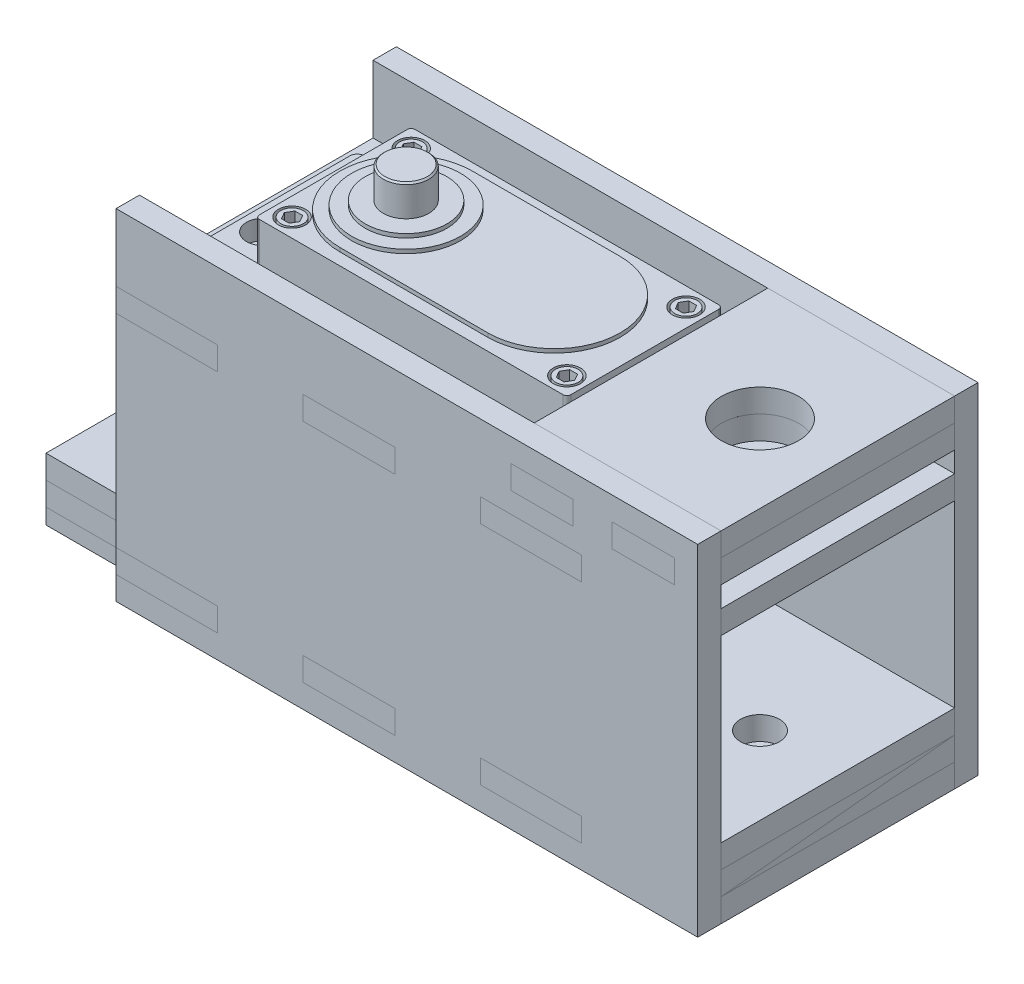
from build123d import *

# Parameters (mm, degrees)
SKETCH_1_W           = 40
SKETCH_1_H           = 37.7
EXTRUDE_1_DEPTH      = 20
SKETCH_2_R           = 1.75
CUT_EXTRUDE_1_DEPTH  = 1.5
SKETCH_3_R           = 1.45
EXTRUDE_2_DEPTH      = 1.5
EXTRUDE_3_DEPTH      = 0.5
SKETCH_5_R           = 7
EXTRUDE_4_DEPTH      = 0.5
SKETCH_6_R           = 5.25
EXTRUDE_5_DEPTH      = 0.5
SKETCH_7_R           = 2.925
EXTRUDE_6_DEPTH      = 4
CHAMFER_1_SIZE       = 0.2
SKETCH_8_W           = 53.8
SKETCH_8_H           = 2.5
EXTRUDE_7_DEPTH      = 20
FILLET_1_R           = 1
SKETCH_9_R           = 2.15
CUT_EXTRUDE_2_DEPTH  = 4
FILLET_2_R           = 0.5
SKETCH_10_W          = 83.8
SKETCH_10_H          = 30
SKETCH_10_R          = 1.25
EXTRUDE_8_DEPTH      = 3
SKETCH_11_W          = 13
SKETCH_11_H          = 3
SKETCH_11_W_2        = 11.8
EXTRUDE_9_DEPTH      = 3
SKETCH_14_W          = 83.8
SKETCH_14_H          = 42.7
SKETCH_14_W_2        = 13
SKETCH_14_H_2        = 3
SKETCH_14_W_3        = 11.8
EXTRUDE_10_DEPTH     = 3
SKETCH_15_W          = 30
SKETCH_15_H          = 3
EXTRUDE_11_DEPTH     = 15
SKETCH_16_W          = 3
SKETCH_16_H          = 42.7
EXTRUDE_12_DEPTH     = 15
SKETCH_17_W          = 3
SKETCH_17_H          = 42.7
EXTRUDE_13_DEPTH     = 15
SKETCH_18_R          = 2.5
CUT_EXTRUDE_3_DEPTH  = 15
SKETCH_19_W          = 25
SKETCH_19_H          = 3
EXTRUDE_14_DEPTH     = 8
SKETCH_20_W          = 25
SKETCH_20_H          = 3
EXTRUDE_15_DEPTH     = 8
SKETCH_21_W          = 30
SKETCH_21_H          = 3
EXTRUDE_16_DEPTH     = 25
SKETCH_22_R          = 2.5
CUT_EXTRUDE_4_DEPTH  = 10
CUT_EXTRUDE_5_DEPTH  = 100
SKETCH_25_W          = 92.969292527
SKETCH_25_H          = 30
EXTRUDE_17_DEPTH     = 3
EXTRUDE_18_DEPTH     = 3
SKETCH_27_R          = 2.5
CUT_EXTRUDE_6_DEPTH  = 3
EXTRUDE_19_DEPTH     = 5
SKETCH_29_R          = 2.5
CUT_EXTRUDE_7_DEPTH  = 13
SKETCH_30_W          = 27.06910603
SKETCH_30_H          = 61.515180942
CUT_EXTRUDE_8_DEPTH  = 76
SKETCH_31_W          = 30
SKETCH_31_H          = 3
EXTRUDE_20_DEPTH     = 10
SKETCH_32_W          = 3
SKETCH_32_H          = 50.7
EXTRUDE_21_DEPTH     = 10
SKETCH_33_W          = 3
SKETCH_33_H          = 50.7
EXTRUDE_22_DEPTH     = 10
SKETCH_34_W          = 30
SKETCH_34_H          = 3
EXTRUDE_23_DEPTH     = 10
SKETCH_35_W          = 30
SKETCH_35_H          = 3
EXTRUDE_24_DEPTH     = 10
SKETCH_36_R          = 2.5
CUT_EXTRUDE_9_DEPTH  = 90
SKETCH_37_W          = 86.7
SKETCH_37_H          = 30
EXTRUDE_25_DEPTH     = 3
SKETCH_38_W          = 86.7
SKETCH_38_H          = 3
EXTRUDE_26_DEPTH     = 1
SKETCH_39_W          = 86.7
SKETCH_39_H          = 3
EXTRUDE_27_DEPTH     = 1
SKETCH_40_W          = 13
SKETCH_40_H          = 3
SKETCH_40_W_2        = 11.8
CUT_EXTRUDE_10_DEPTH = 45
SKETCH_41_W          = 13
SKETCH_41_H          = 3
SKETCH_41_W_2        = 11.8
CUT_EXTRUDE_11_DEPTH = 59
EXTRUDE_28_DEPTH     = 3
SKETCH_43_W          = 3
SKETCH_43_H          = 8
EXTRUDE_29_DEPTH     = 3
SKETCH_44_W          = 3
SKETCH_44_H          = 8
EXTRUDE_30_DEPTH     = 3
SKETCH_45_W          = 30
SKETCH_45_H          = 3
EXTRUDE_31_DEPTH     = 3
SKETCH_50_W          = 49.998763717
SKETCH_50_H          = 60.966477852
CUT_EXTRUDE_12_DEPTH = 12
SKETCH_51_R          = 4.95
CUT_EXTRUDE_13_DEPTH = 66
SKETCH_52_W          = 30
SKETCH_52_H          = 3
EXTRUDE_36_DEPTH     = 2
SKETCH_53_W          = 26.558022485
SKETCH_53_H          = 47.961323307
CUT_EXTRUDE_14_DEPTH = 8
SKETCH_54_W          = 15
SKETCH_54_H          = 3
EXTRUDE_37_DEPTH     = 5
SKETCH_55_W          = 8
SKETCH_55_H          = 3
CUT_EXTRUDE_15_DEPTH = 50
SKETCH_56_W          = 3
SKETCH_56_H          = 5
CUT_EXTRUDE_16_DEPTH = 50
EXTRUDE_38_DEPTH     = 3
SKETCH_59_R          = 4.95
CUT_EXTRUDE_17_DEPTH = 25
SKETCH_60_W          = 24
SKETCH_60_H          = 30
SKETCH_60_R          = 4.95
EXTRUDE_39_DEPTH     = 3
SKETCH_61_W          = 24
SKETCH_61_H          = 30
SKETCH_61_R          = 4.95
EXTRUDE_40_DEPTH     = 3


with BuildPart() as part:
    # 草图1 → 凸台-拉伸1 (new body)
    with BuildSketch(Plane.XY):
        Rectangle(SKETCH_1_W, SKETCH_1_H)
    extrude(amount=EXTRUDE_1_DEPTH)

    # 草图2 → 切除-拉伸1 (cut)
    with BuildSketch(Plane(origin=(0, 18.85, 0), x_dir=(1, 0, 0), z_dir=(0, 1, 0))):
        with Locations(Location((-17.65, -2.35, 0), (0, 0, 270))):
            Circle(SKETCH_2_R)
        with Locations(Location((17.65, -2.35, 0), (0, 0, 90))):
            Circle(SKETCH_2_R)
        with Locations(Location((17.65, -17.65, 0), (0, 0, 270))):
            Circle(SKETCH_2_R)
        with Locations(Location((-17.65, -17.65, 0), (0, 0, 90))):
            Circle(SKETCH_2_R)
    cut_extrude_1 = extrude(amount=-CUT_EXTRUDE_1_DEPTH, mode=Mode.SUBTRACT)

    # 草图3 → 凸台-拉伸2 (add)
    # profile 1 of 4: a face of its own
    with BuildSketch(Plane(origin=(0, 17.35, 0), x_dir=(1, 0, 0), z_dir=(0, 1, 0))):
        with Locations(Location((-17.65, -2.35, 0), (0, 0, 270))):
            Circle(SKETCH_3_R)
        Polygon((-17.15, -1.483974596), (-18.15, -1.483974596), (-18.65, -2.35), (-18.15, -3.216025404), (-17.15, -3.216025404), (-16.65, -2.35), align=None, mode=Mode.SUBTRACT)
    # profile 2 of 4: a face of its own
    with BuildSketch(Plane(origin=(0, 17.35, 0), x_dir=(1, 0, 0), z_dir=(0, 1, 0))):
        with Locations(Location((17.65, -2.35, 0), (0, 0, 90))):
            Circle(SKETCH_3_R)
        Polygon((16.65, -2.35), (17.15, -1.483974596), (18.15, -1.483974596), (18.65, -2.35), (18.15, -3.216025404), (17.15, -3.216025404), align=None, mode=Mode.SUBTRACT)
    # profile 3 of 4: a face of its own
    with BuildSketch(Plane(origin=(0, 17.35, 0), x_dir=(1, 0, 0), z_dir=(0, 1, 0))):
        with Locations(Location((-17.65, -17.65, 0), (0, 0, 90))):
            Circle(SKETCH_3_R)
        Polygon((-17.15, -18.516025404), (-18.15, -18.516025404), (-18.65, -17.65), (-18.15, -16.783974596), (-17.15, -16.783974596), (-16.65, -17.65), align=None, mode=Mode.SUBTRACT)
    # profile 4 of 4: a face of its own
    with BuildSketch(Plane(origin=(0, 17.35, 0), x_dir=(1, 0, 0), z_dir=(0, 1, 0))):
        with Locations(Location((17.65, -17.65, 0), (0, 0, 270))):
            Circle(SKETCH_3_R)
        Polygon((16.65, -17.65), (17.15, -18.516025404), (18.15, -18.516025404), (18.65, -17.65), (18.15, -16.783974596), (17.15, -16.783974596), align=None, mode=Mode.SUBTRACT)
    extrude_2 = extrude(amount=EXTRUDE_2_DEPTH)

    # 草图4 → 凸台-拉伸3 (add)
    with BuildSketch(Plane(origin=(0, 18.85, 0), x_dir=(1, 0, 0), z_dir=(0, 1, 0))):
        with BuildLine():
            Line((-10.7, -1.45), (8.3, -1.45))
            ThreePointArc((8.3, -1.45), (16.8, -9.95), (8.3, -18.45))
            Line((8.3, -18.45), (-10.7, -18.45))
            ThreePointArc((-10.7, -18.45), (-19.2, -9.95), (-10.7, -1.45))
        make_face()
    extrude(amount=EXTRUDE_3_DEPTH)

    # 草图5 → 凸台-拉伸4 (add)
    with BuildSketch(Plane(origin=(0, 19.35, 0), x_dir=(1, 0, 0), z_dir=(0, 1, 0))):
        with Locations(Location((-10.7, -9.95, 0), (0, 0, 270))):
            Circle(SKETCH_5_R)
    extrude(amount=EXTRUDE_4_DEPTH)

    # 草图6 → 凸台-拉伸5 (add)
    with BuildSketch(Plane(origin=(0, 19.85, 0), x_dir=(1, 0, 0), z_dir=(0, 1, 0))):
        with Locations(Location((-10.7, -9.95, 0), (0, 0, 270))):
            Circle(SKETCH_6_R)
    extrude(amount=EXTRUDE_5_DEPTH)

    # 草图7 → 凸台-拉伸6 (add)
    with BuildSketch(Plane(origin=(0, 20.35, 0), x_dir=(1, 0, 0), z_dir=(0, 1, 0))):
        with Locations(Location((-10.7, -9.95, 0), (0, 0, 270))):
            Circle(SKETCH_7_R)
    extrude(amount=EXTRUDE_6_DEPTH)

    # 倒角1
    chamfer_1_edges = [part.edges().sort_by_distance(p)[0] for p in [
        (-10.7, 24.35, 7.025),
    ]]
    chamfer(chamfer_1_edges, length=CHAMFER_1_SIZE)

    # 草图8 → 凸台-拉伸7 (add)
    with BuildSketch(Plane.XY.offset(20)):
        with Locations((0, 11.45)):
            Rectangle(SKETCH_8_W, SKETCH_8_H)
    extrude(amount=-EXTRUDE_7_DEPTH)

    # 镜向1: 切除-拉伸1, 凸台-拉伸2 across plane
    add(cut_extrude_1.mirror(Plane.ZX), mode=Mode.SUBTRACT)
    add(extrude_2.mirror(Plane.ZX))

    # 圆角1
    fillet_1_edges = [part.edges().sort_by_distance(p)[0] for p in [
        (26.9, 11.45, 20),
        (-26.9, 11.45, 20),
        (26.9, 11.45, 0),
        (-26.9, 11.45, 0),
    ]]
    fillet(fillet_1_edges, radius=FILLET_1_R)

    # 草图9 → 切除-拉伸2 (cut)
    with BuildSketch(Plane(origin=(0, 12.7, 0), x_dir=(1, 0, 0), z_dir=(0, 1, 0))):
        with Locations(Location((-24, -5, 0), (0, 0, 270))):
            Circle(SKETCH_9_R)
        with Locations(Location((-24, -15, 0), (0, 0, 270))):
            Circle(SKETCH_9_R)
        with Locations(Location((24, -15, 0), (0, 0, 90))):
            Circle(SKETCH_9_R)
        with Locations(Location((24, -5, 0), (0, 0, 90))):
            Circle(SKETCH_9_R)
    extrude(amount=-CUT_EXTRUDE_2_DEPTH, mode=Mode.SUBTRACT)

    # 圆角2
    fillet_2_edges = [part.edges().sort_by_distance(p)[0] for p in [
        (-20, 15.775, 20),
        (20, 15.775, 0),
        (-20, -4.325, 0),
        (20, 15.775, 20),
        (-20, -4.325, 20),
        (20, -4.325, 20),
        (-20, 15.775, 0),
        (20, -4.325, 0),
    ]]
    fillet(fillet_2_edges, radius=FILLET_2_R)


with BuildPart() as body_2:
    # 草图10 → 凸台-拉伸8 (new body)
    with BuildSketch(Plane.XZ.offset(-10.2)):
        with Locations((0, 10)):
            Rectangle(SKETCH_10_W, SKETCH_10_H)
        with Locations(Location((-24, 15, 0), (0, 0, 270))):
            Circle(SKETCH_10_R, mode=Mode.SUBTRACT)
        with Locations(Location((-24, 5, 0), (0, 0, 270))):
            Circle(SKETCH_10_R, mode=Mode.SUBTRACT)
        with Locations(Location((24, 5, 0), (0, 0, 270))):
            Circle(SKETCH_10_R, mode=Mode.SUBTRACT)
        with Locations(Location((24, 15, 0), (0, 0, 270))):
            Circle(SKETCH_10_R, mode=Mode.SUBTRACT)
        with BuildLine():
            Line((20, 19.5), (20, 0.5))
            ThreePointArc((20, 0.5), (19.853553391, 0.146446609), (19.5, 0))
            Line((19.5, 0), (-19.5, 0))
            ThreePointArc((-19.5, 0), (-19.853553391, 0.146446609), (-20, 0.5))
            Line((-20, 0.5), (-20, 19.5))
            ThreePointArc((-20, 19.5), (-19.853553391, 19.853553391), (-19.5, 20))
            Line((-19.5, 20), (19.5, 20))
            ThreePointArc((19.5, 20), (19.853553391, 19.853553391), (20, 19.5))
        make_face(mode=Mode.SUBTRACT)
    extrude(amount=EXTRUDE_8_DEPTH)

    # 草图11 → 凸台-拉伸9 (add)
    with BuildSketch(Plane(origin=(0, 0, -5), x_dir=(-1, 0, 0), z_dir=(0, 0, -1))):
        with Locations((-23.4, 8.7)):
            Rectangle(SKETCH_11_W, SKETCH_11_H)
        with Locations((23.4, 8.7)):
            Rectangle(SKETCH_11_W, SKETCH_11_H)
        with Locations((0, 8.7)):
            Rectangle(SKETCH_11_W_2, SKETCH_11_H)
    extrude_9 = extrude(amount=EXTRUDE_9_DEPTH)

    # 镜向2: 凸台-拉伸9 across plane
    add(extrude_9.mirror(Plane(origin=(0, 0, 10), x_dir=(1, 0, 0), z_dir=(0, 0, -1))))

    # 草图15 → 凸台-拉伸11 (add)
    with BuildSketch(Plane(origin=(41.9, 0, 0), x_dir=(0, 0, -1), z_dir=(1, 0, 0))):
        with Locations((-10, 8.7)):
            Rectangle(SKETCH_15_W, SKETCH_15_H)
    extrude(amount=EXTRUDE_11_DEPTH)

    # 草图18 → 切除-拉伸3 (cut)
    with BuildSketch(Plane(origin=(0, 10.2, 0), x_dir=(1, 0, 0), z_dir=(0, 1, 0))):
        with Locations(Location((52.3, -10, 0), (0, 0, 270))):
            Circle(SKETCH_18_R)
    extrude(amount=-CUT_EXTRUDE_3_DEPTH, mode=Mode.SUBTRACT)


with BuildPart() as body_3:
    # 草图14 → 凸台-拉伸10 (new body)
    with BuildSketch(Plane(origin=(0, 0, -5), x_dir=(-1, 0, 0), z_dir=(0, 0, -1))):
        with Locations((0, -2.5)):
            Rectangle(SKETCH_14_W, SKETCH_14_H)
        with Locations((23.4, 8.7)):
            Rectangle(SKETCH_14_W_2, SKETCH_14_H_2, mode=Mode.SUBTRACT)
        with Locations((0, 8.7)):
            Rectangle(SKETCH_14_W_3, SKETCH_14_H_2, mode=Mode.SUBTRACT)
        with Locations((-23.4, 8.7)):
            Rectangle(SKETCH_14_W_2, SKETCH_14_H_2, mode=Mode.SUBTRACT)
    extrude(amount=EXTRUDE_10_DEPTH)


with BuildPart() as body_4:
    # 镜向3: mirrored copy
    add(body_3.part.mirror(Plane(origin=(0, 0, 10), x_dir=(1, 0, 0), z_dir=(0, 0, -1))))

    # 草图17 → 凸台-拉伸13 (add)
    with BuildSketch(Plane(origin=(41.9, 0, 0), x_dir=(0, 0, -1), z_dir=(1, 0, 0))):
        with Locations((-26.5, -2.5)):
            Rectangle(SKETCH_17_W, SKETCH_17_H)
    extrude(amount=EXTRUDE_13_DEPTH)

    # 草图20 → 凸台-拉伸15 (add)
    with BuildSketch(Plane(origin=(0, 18.85, 0), x_dir=(1, 0, 0), z_dir=(0, 1, 0))):
        with Locations((44.4, -26.5)):
            Rectangle(SKETCH_20_W, SKETCH_20_H)
    extrude(amount=EXTRUDE_15_DEPTH)


with BuildPart() as body_3_1:
    add(body_3.part)

    # 草图16 → 凸台-拉伸12 (add)
    with BuildSketch(Plane(origin=(41.9, 0, 0), x_dir=(0, 0, -1), z_dir=(1, 0, 0))):
        with Locations((6.5, -2.5)):
            Rectangle(SKETCH_16_W, SKETCH_16_H)
    extrude(amount=EXTRUDE_12_DEPTH)

    # 草图19 → 凸台-拉伸14 (add)
    with BuildSketch(Plane(origin=(0, 18.85, 0), x_dir=(1, 0, 0), z_dir=(0, 1, 0))):
        with Locations((44.4, 6.5)):
            Rectangle(SKETCH_19_W, SKETCH_19_H)
    extrude(amount=EXTRUDE_14_DEPTH)


with BuildPart() as body_5:
    # 草图21 → 凸台-拉伸16 (new body)
    with BuildSketch(Plane(origin=(56.9, 0, 0), x_dir=(0, 0, -1), z_dir=(1, 0, 0))):
        with Locations((-10, 25.35)):
            Rectangle(SKETCH_21_W, SKETCH_21_H)
    extrude(amount=-EXTRUDE_16_DEPTH)

    # 草图22 → 切除-拉伸4 (cut)
    with BuildSketch(Plane.XZ.offset(-23.85)):
        with Locations(Location((52.3, 10, 0), (0, 0, 90))):
            Circle(SKETCH_22_R)
    extrude(amount=-CUT_EXTRUDE_4_DEPTH, mode=Mode.SUBTRACT)


with BuildPart() as cut_extrude_5_tool:
    # 草图23 → 切除-拉伸5 (new body)
    with BuildSketch(Plane(origin=(0, 26.85, 0), x_dir=(1, 0, 0), z_dir=(0, 1, 0))):
        with BuildLine():
            Line((56.9, -28), (47.646592012, -28))
            ThreePointArc((47.646592012, -28), (56.954368003, -10), (47.646592012, 8))
            Line((47.646592012, 8), (56.9, 8))
            Line((56.9, 8), (79.268481272, 8))
            Line((79.268481272, 8), (56.9, -28))
        make_face()
    extrude(amount=-CUT_EXTRUDE_5_DEPTH)


with BuildPart() as body_2_1:
    add(body_2.part)

    # 切除-拉伸5: cut by cut_extrude_5_tool
    add(cut_extrude_5_tool.part, mode=Mode.SUBTRACT)


with BuildPart() as body_3_2:
    add(body_3_1.part)

    # 切除-拉伸5: cut by cut_extrude_5_tool
    add(cut_extrude_5_tool.part, mode=Mode.SUBTRACT)


with BuildPart() as body_4_1:
    add(body_4.part)

    # 切除-拉伸5: cut by cut_extrude_5_tool
    add(cut_extrude_5_tool.part, mode=Mode.SUBTRACT)


with BuildPart() as body_5_1:
    add(body_5.part)

    # 切除-拉伸5: cut by cut_extrude_5_tool
    add(cut_extrude_5_tool.part, mode=Mode.SUBTRACT)


with BuildPart() as body_6:
    # 草图25 → 凸台-拉伸17 (new body)
    with BuildSketch(Plane.XZ.offset(18.85)):
        with Locations((4.584646263, 10)):
            Rectangle(SKETCH_25_W, SKETCH_25_H)
        with BuildLine():
            Line((-20, 19.5), (-20, 0.5))
            ThreePointArc((-20, 0.5), (-19.853553391, 0.146446609), (-19.5, 0))
            Line((-19.5, 0), (19.5, 0))
            ThreePointArc((19.5, 0), (19.853553391, 0.146446609), (20, 0.5))
            Line((20, 0.5), (20, 19.5))
            ThreePointArc((20, 19.5), (19.853553391, 19.853553391), (19.5, 20))
            Line((19.5, 20), (-19.5, 20))
            ThreePointArc((-19.5, 20), (-19.853553391, 19.853553391), (-20, 19.5))
        make_face(mode=Mode.SUBTRACT)
    extrude(amount=-EXTRUDE_17_DEPTH)

    # 草图26 → 凸台-拉伸18 (add)
    with BuildSketch(Plane.XZ.offset(18.85)):
        with BuildLine():
            Line((56.9, 11.547778408), (56.9, 8.452221592))
            ThreePointArc((56.9, 8.452221592), (55.134978269, 1.227512897), (51.069292527, -5))
            Line((51.069292527, -5), (51.069292527, 25))
            ThreePointArc((51.069292527, 25), (55.134978269, 18.772487103), (56.9, 11.547778408))
        make_face()
    extrude(amount=-EXTRUDE_18_DEPTH)

    # 草图27 → 切除-拉伸6 (cut)
    with BuildSketch(Plane(origin=(0, -15.85, 0), x_dir=(1, 0, 0), z_dir=(0, 1, 0))):
        with Locations(Location((52.3, -10, 0), (0, 0, 270))):
            Circle(SKETCH_27_R)
    extrude(amount=-CUT_EXTRUDE_6_DEPTH, mode=Mode.SUBTRACT)


with BuildPart() as body_7:
    # 草图28 → 凸台-拉伸19 (new body)
    with BuildSketch(Plane.XZ.offset(18.85)):
        with BuildLine():
            Line((-41.9, 25), (-41.9, -5))
            Line((-41.9, -5), (51.069292527, -5))
            ThreePointArc((51.069292527, -5), (55.134978269, 1.227512897), (56.9, 8.452221592))
            Line((56.9, 8.452221592), (56.9, 11.547778408))
            ThreePointArc((56.9, 11.547778408), (55.134978269, 18.772487103), (51.069292527, 25))
            Line((51.069292527, 25), (-41.9, 25))
        make_face()
    extrude(amount=EXTRUDE_19_DEPTH)

    # 草图29 → 切除-拉伸7 (cut)
    with BuildSketch(Plane(origin=(0, -18.85, 0), x_dir=(1, 0, 0), z_dir=(0, 1, 0))):
        with Locations(Location((52.3, -10, 0), (0, 0, 270))):
            Circle(SKETCH_29_R)
    extrude(amount=-CUT_EXTRUDE_7_DEPTH, mode=Mode.SUBTRACT)


with BuildPart() as cut_extrude_8_tool:
    # 草图30 → 切除-拉伸8 (new body)
    with BuildSketch(Plane(origin=(0, 26.85, 0), x_dir=(1, 0, 0), z_dir=(0, 1, 0))):
        with Locations((48.334553015, -10)):
            Rectangle(SKETCH_30_W, SKETCH_30_H)
    extrude(amount=-CUT_EXTRUDE_8_DEPTH)


with BuildPart() as body_2_2:
    add(body_2_1.part)

    # 切除-拉伸8: cut by cut_extrude_8_tool
    add(cut_extrude_8_tool.part, mode=Mode.SUBTRACT)

    # 草图34 → 凸台-拉伸23 (add)
    with BuildSketch(Plane(origin=(34.8, 0, 0), x_dir=(0, 0, -1), z_dir=(1, 0, 0))):
        with Locations((-10, 8.7)):
            Rectangle(SKETCH_34_W, SKETCH_34_H)
    extrude(amount=EXTRUDE_23_DEPTH)


with BuildPart() as body_3_3:
    add(body_3_2.part)

    # 切除-拉伸8: cut by cut_extrude_8_tool
    add(cut_extrude_8_tool.part, mode=Mode.SUBTRACT)

    # 草图32 → 凸台-拉伸21 (add)
    with BuildSketch(Plane(origin=(34.8, 0, 0), x_dir=(0, 0, -1), z_dir=(1, 0, 0))):
        with Locations((6.5, 1.5)):
            Rectangle(SKETCH_32_W, SKETCH_32_H)
    extrude(amount=EXTRUDE_21_DEPTH)

    # 草图38 → 凸台-拉伸26 (add)
    with BuildSketch(Plane.XZ.offset(23.85)):
        with Locations((1.45, -6.5)):
            Rectangle(SKETCH_38_W, SKETCH_38_H)
    extrude(amount=EXTRUDE_26_DEPTH)

    # 草图41 → 切除-拉伸11 (cut)
    with BuildSketch(Plane.XY.offset(-5)):
        with Locations((23.4, -20.35)):
            Rectangle(SKETCH_41_W, SKETCH_41_H)
        with Locations((0, -20.35)):
            Rectangle(SKETCH_41_W_2, SKETCH_41_H)
        with Locations((-23.4, -20.35)):
            Rectangle(SKETCH_41_W, SKETCH_41_H)
    extrude(amount=-CUT_EXTRUDE_11_DEPTH, mode=Mode.SUBTRACT)

    # 草图43 → 凸台-拉伸29 (add)
    with BuildSketch(Plane.ZY.offset(-31.9)):
        with Locations((-6.5, 22.85)):
            Rectangle(SKETCH_43_W, SKETCH_43_H)
    extrude(amount=EXTRUDE_29_DEPTH)


with BuildPart() as body_4_2:
    add(body_4_1.part)

    # 切除-拉伸8: cut by cut_extrude_8_tool
    add(cut_extrude_8_tool.part, mode=Mode.SUBTRACT)

    # 草图33 → 凸台-拉伸22 (add)
    with BuildSketch(Plane(origin=(34.8, 0, 0), x_dir=(0, 0, -1), z_dir=(1, 0, 0))):
        with Locations((-26.5, 1.5)):
            Rectangle(SKETCH_33_W, SKETCH_33_H)
    extrude(amount=EXTRUDE_22_DEPTH)

    # 草图39 → 凸台-拉伸27 (add)
    with BuildSketch(Plane.XZ.offset(23.85)):
        with Locations((1.45, 26.5)):
            Rectangle(SKETCH_39_W, SKETCH_39_H)
    extrude(amount=EXTRUDE_27_DEPTH)

    # 草图40 → 切除-拉伸10 (cut)
    with BuildSketch(Plane.XY.offset(28)):
        with Locations((-23.4, -20.35)):
            Rectangle(SKETCH_40_W, SKETCH_40_H)
        with Locations((0, -20.35)):
            Rectangle(SKETCH_40_W_2, SKETCH_40_H)
        with Locations((23.4, -20.35)):
            Rectangle(SKETCH_40_W, SKETCH_40_H)
    extrude(amount=-CUT_EXTRUDE_10_DEPTH, mode=Mode.SUBTRACT)

    # 草图44 → 凸台-拉伸30 (add)
    with BuildSketch(Plane.ZY.offset(-31.9)):
        with Locations((26.5, 22.85)):
            Rectangle(SKETCH_44_W, SKETCH_44_H)
    extrude(amount=EXTRUDE_30_DEPTH)


with BuildPart() as body_5_2:
    add(body_5_1.part)

    # 切除-拉伸8: cut by cut_extrude_8_tool
    add(cut_extrude_8_tool.part, mode=Mode.SUBTRACT)

    # 草图31 → 凸台-拉伸20 (add)
    with BuildSketch(Plane(origin=(34.8, 0, 0), x_dir=(0, 0, -1), z_dir=(1, 0, 0))):
        with Locations((-10, 25.35)):
            Rectangle(SKETCH_31_W, SKETCH_31_H)
    extrude(amount=EXTRUDE_20_DEPTH)


with BuildPart() as body_6_1:
    add(body_6.part)

    # 切除-拉伸8: cut by cut_extrude_8_tool
    add(cut_extrude_8_tool.part, mode=Mode.SUBTRACT)

    # 草图35 → 凸台-拉伸24 (add)
    with BuildSketch(Plane(origin=(34.8, 0, 0), x_dir=(0, 0, -1), z_dir=(1, 0, 0))):
        with Locations((-10, -17.35)):
            Rectangle(SKETCH_35_W, SKETCH_35_H)
    extrude(amount=EXTRUDE_24_DEPTH)


with BuildPart() as body_7_1:
    add(body_7.part)

    # 切除-拉伸8: cut by cut_extrude_8_tool
    add(cut_extrude_8_tool.part, mode=Mode.SUBTRACT)


with BuildPart() as cut_extrude_9_tool:
    # 草图36 → 切除-拉伸9 (new body)
    with BuildSketch(Plane(origin=(0, 26.85, 0), x_dir=(1, 0, 0), z_dir=(0, 1, 0))):
        with Locations(Location((34.8, -10, 0), (0, 0, 270))):
            Circle(SKETCH_36_R)
    extrude(amount=-CUT_EXTRUDE_9_DEPTH)


with BuildPart() as body_2_3:
    add(body_2_2.part)

    # 切除-拉伸9: cut by cut_extrude_9_tool
    add(cut_extrude_9_tool.part, mode=Mode.SUBTRACT)


with BuildPart() as body_5_3:
    add(body_5_2.part)

    # 切除-拉伸9: cut by cut_extrude_9_tool
    add(cut_extrude_9_tool.part, mode=Mode.SUBTRACT)

    # 草图45 → 凸台-拉伸31 (add)
    with BuildSketch(Plane.ZY.offset(-31.9)):
        with Locations((10, 25.35)):
            Rectangle(SKETCH_45_W, SKETCH_45_H)
    extrude(amount=EXTRUDE_31_DEPTH)


with BuildPart() as body_6_2:
    add(body_6_1.part)

    # 切除-拉伸9: cut by cut_extrude_9_tool
    add(cut_extrude_9_tool.part, mode=Mode.SUBTRACT)


with BuildPart() as body_7_2:
    add(body_7_1.part)

    # 切除-拉伸9: cut by cut_extrude_9_tool
    add(cut_extrude_9_tool.part, mode=Mode.SUBTRACT)


with BuildPart() as body_8:
    # 草图37 → 凸台-拉伸25 (new body)
    with BuildSketch(Plane.XZ.offset(18.85)):
        with Locations((1.45, 10)):
            Rectangle(SKETCH_37_W, SKETCH_37_H)
    extrude(amount=EXTRUDE_25_DEPTH)


with BuildPart() as body_9:
    # 草图42 → 凸台-拉伸28 (new body)
    with BuildSketch(Plane.XZ.offset(18.85)):
        Polygon((29.9, -5), (44.8, -5), (44.8, 25), (29.9, 25), (29.9, 28), (16.9, 28), (16.9, 25), (5.9, 25), (5.9, 28), (-5.9, 28), (-5.9, 25), (-16.9, 25), (-16.9, 28), (-29.9, 28), (-29.9, 25), (-41.9, 25), (-41.9, -5), (-29.9, -5), (-29.9, -8), (-16.9, -8), (-16.9, -5), (-5.9, -5), (-5.9, -8), (5.9, -8), (5.9, -5), (16.9, -5), (16.9, -8), (29.9, -8), align=None)
    extrude(amount=EXTRUDE_28_DEPTH)


with BuildPart() as cut_extrude_12_tool:
    # 草图50 → 切除-拉伸12 (new body)
    with BuildSketch(Plane.ZY.offset(41.9)):
        with Locations((10.751484424, 0)):
            Rectangle(SKETCH_50_W, SKETCH_50_H)
    extrude(amount=-CUT_EXTRUDE_12_DEPTH)


with BuildPart() as body_2_4:
    add(body_2_3.part)

    # 切除-拉伸12: cut by cut_extrude_12_tool
    add(cut_extrude_12_tool.part, mode=Mode.SUBTRACT)


with BuildPart() as body_9_1:
    add(body_9.part)

    # 切除-拉伸12: cut by cut_extrude_12_tool
    add(cut_extrude_12_tool.part, mode=Mode.SUBTRACT)


with BuildPart() as body_3_4:
    add(body_3_3.part)

    # 切除-拉伸12: cut by cut_extrude_12_tool
    add(cut_extrude_12_tool.part, mode=Mode.SUBTRACT)


with BuildPart() as body_4_3:
    add(body_4_2.part)

    # 切除-拉伸12: cut by cut_extrude_12_tool
    add(cut_extrude_12_tool.part, mode=Mode.SUBTRACT)


with BuildPart() as cut_extrude_13_tool:
    # 草图51 → 切除-拉伸13 (new body)
    with BuildSketch(Plane(origin=(0, 26.85, 0), x_dir=(1, 0, 0), z_dir=(0, 1, 0))):
        with Locations(Location((34.8, -10, 0), (0, 0, 180))):
            Circle(SKETCH_51_R)
    extrude(amount=-CUT_EXTRUDE_13_DEPTH)


with BuildPart() as body_5_4:
    add(body_5_3.part)

    # 切除-拉伸13: cut by cut_extrude_13_tool
    add(cut_extrude_13_tool.part, mode=Mode.SUBTRACT)

    # 草图52 → 凸台-拉伸36 (add)
    with BuildSketch(Plane.ZY.offset(-28.9)):
        with Locations((10, 25.35)):
            Rectangle(SKETCH_52_W, SKETCH_52_H)
    extrude(amount=EXTRUDE_36_DEPTH)


with BuildPart() as body_2_5:
    add(body_2_4.part)

    # 切除-拉伸13: cut by cut_extrude_13_tool
    add(cut_extrude_13_tool.part, mode=Mode.SUBTRACT)


with BuildPart() as body_9_2:
    add(body_9_1.part)

    # 切除-拉伸13: cut by cut_extrude_13_tool
    add(cut_extrude_13_tool.part, mode=Mode.SUBTRACT)


with BuildPart() as cut_extrude_14_tool:
    # 草图53 → 切除-拉伸14 (new body)
    with BuildSketch(Plane(origin=(0, 26.85, 0), x_dir=(1, 0, 0), z_dir=(0, 1, 0))):
        with Locations((35.464791652, -11.484783957)):
            Rectangle(SKETCH_53_W, SKETCH_53_H)
    extrude(amount=-CUT_EXTRUDE_14_DEPTH)


with BuildPart() as body_3_5:
    add(body_3_4.part)

    # 切除-拉伸14: cut by cut_extrude_14_tool
    add(cut_extrude_14_tool.part, mode=Mode.SUBTRACT)



with BuildPart() as body_4_4:
    add(body_4_3.part)

    # 切除-拉伸14: cut by cut_extrude_14_tool
    add(cut_extrude_14_tool.part, mode=Mode.SUBTRACT)


with BuildPart() as body_5_5:
    add(body_5_4.part)

    # 切除-拉伸14: cut by cut_extrude_14_tool
    add(cut_extrude_14_tool.part, mode=Mode.SUBTRACT)


with BuildPart() as body_3_6:
    add(body_3_5.part)

    add(body_4_4.part)  # 凸台-拉伸37 merges body 4
    # 草图54 → 凸台-拉伸37 (add)
    with BuildSketch(Plane(origin=(0, 18.85, 0), x_dir=(1, 0, 0), z_dir=(0, 1, 0))):
        with Locations((37.3, 6.5)):
            Rectangle(SKETCH_54_W, SKETCH_54_H)
        with Locations((37.3, -26.5)):
            Rectangle(SKETCH_54_W, SKETCH_54_H)
    extrude(amount=EXTRUDE_37_DEPTH)

    # 草图55 → 切除-拉伸15 (cut)
    with BuildSketch(Plane.XY.offset(28)):
        with Locations((24.8, 14.35)):
            Rectangle(SKETCH_55_W, SKETCH_55_H)
        with Locations((37.8, 14.35)):
            Rectangle(SKETCH_55_W, SKETCH_55_H)
    extrude(amount=-CUT_EXTRUDE_15_DEPTH, mode=Mode.SUBTRACT)

    # 草图56 → 切除-拉伸16 (cut)
    with BuildSketch(Plane.ZY.offset(-29.8)):
        with Locations((-6.5, 21.35)):
            Rectangle(SKETCH_56_W, SKETCH_56_H)
        with Locations((26.5, 21.35)):
            Rectangle(SKETCH_56_W, SKETCH_56_H)
    extrude(amount=-CUT_EXTRUDE_16_DEPTH, mode=Mode.SUBTRACT)


with BuildPart() as body_8_2:
    # 草图58 → 凸台-拉伸38 (new body)
    with BuildSketch(Plane(origin=(0, 12.85, 0), x_dir=(1, 0, 0), z_dir=(0, 1, 0))):
        Polygon((20.8, 8), (20.8, -28), (28.8, -28), (28.8, -25), (33.8, -25), (33.8, -28), (41.8, -28), (41.8, -25), (44.8, -25), (44.8, 5), (41.8, 5), (41.8, 8), (33.8, 8), (33.8, 5), (28.8, 5), (28.8, 8), align=None)
    extrude(amount=EXTRUDE_38_DEPTH)

    # 草图59 → 切除-拉伸17 (cut)
    with BuildSketch(Plane.XZ.offset(-12.85)):
        with Locations(Location((34.8, 10, 0), (0, 0, 270))):
            Circle(SKETCH_59_R)
    extrude(amount=-CUT_EXTRUDE_17_DEPTH, mode=Mode.SUBTRACT)


with BuildPart() as body_9_2_1:
    # 草图60 → 凸台-拉伸39 (new body)
    with BuildSketch(Plane(origin=(0, 15.85, 0), x_dir=(1, 0, 0), z_dir=(0, 1, 0))):
        with Locations((32.8, -10)):
            Rectangle(SKETCH_60_W, SKETCH_60_H)
        with Locations(Location((34.8, -10, 0), (0, 0, 90))):
            Circle(SKETCH_60_R, mode=Mode.SUBTRACT)
    extrude(amount=EXTRUDE_39_DEPTH)


with BuildPart() as body_10:
    # 草图61 → 凸台-拉伸40 (new body)
    with BuildSketch(Plane.XZ.offset(21.85)):
        with Locations((32.8, 10)):
            Rectangle(SKETCH_61_W, SKETCH_61_H)
        with Locations(Location((34.8, 10, 0), (0, 0, 270))):
            Circle(SKETCH_61_R, mode=Mode.SUBTRACT)
    extrude(amount=EXTRUDE_40_DEPTH)


solid = Compound([part.part, body_6_2.part, body_7_2.part, body_8.part, body_2_5.part, body_9_2.part, body_3_6.part, body_8_2.part, body_9_2_1.part, body_10.part])
